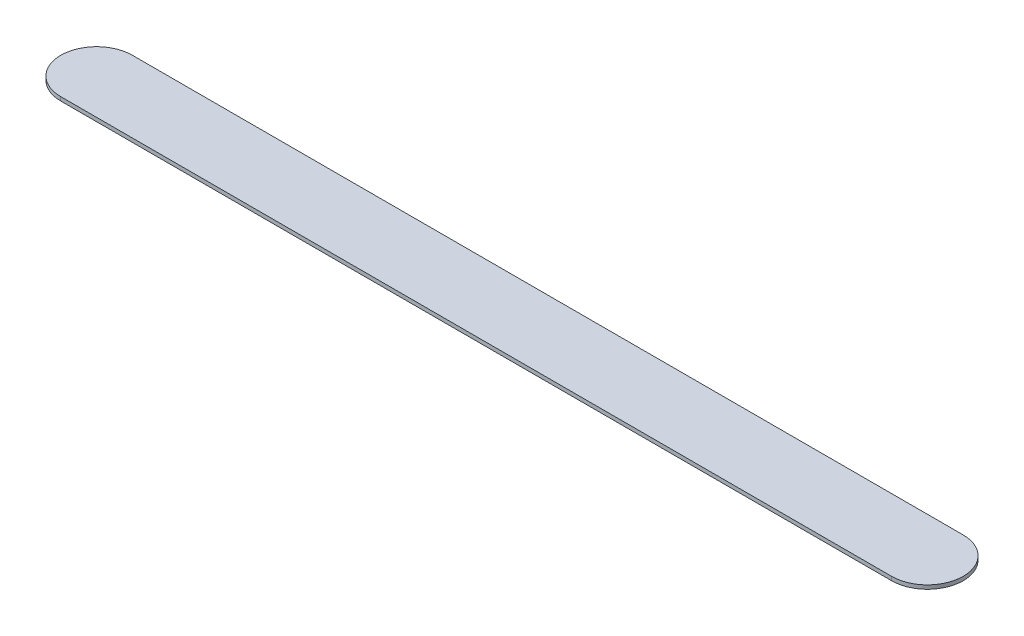
from build123d import *

# Parameters (mm, degrees)
BASE_FLANGE1_DEPTH = 0.7366


# Sheet-metal steps are written as plain solids
with BuildPart() as part:
    # Sketch1 → Base-Flange1 (new body)
    with BuildSketch(Plane(origin=(0, 0, 0), x_dir=(1, 0, 0), z_dir=(0, 1, 0))):
        with BuildLine():
            Line((0, 6.9), (160, 6.9))
            ThreePointArc((160, 6.9), (166.9, 0), (160, -6.9))
            Line((160, -6.9), (0, -6.9))
            ThreePointArc((0, -6.9), (-6.9, 0), (0, 6.9))
        make_face()
    extrude(amount=-BASE_FLANGE1_DEPTH)


solid = part.part
